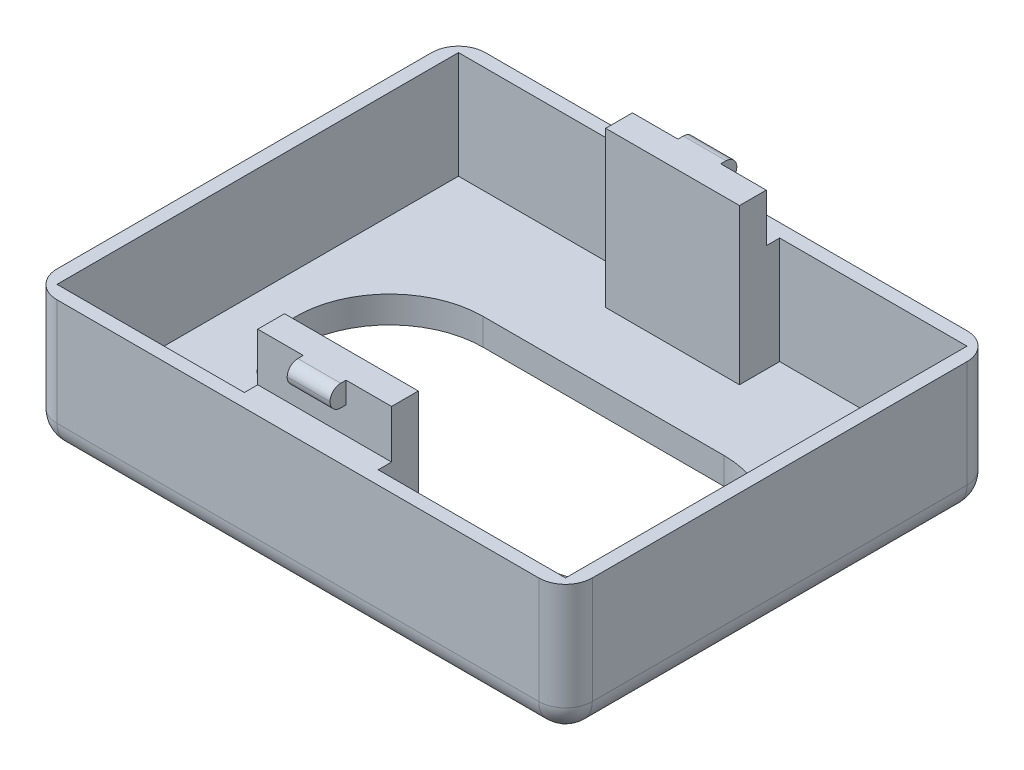
from build123d import *

# Parameters (mm, degrees)
SKETCH1_W            = 100
SKETCH1_H            = 80
BOSS_EXTRUDE1_DEPTH  = 5
SKETCH2_W            = 100
SKETCH2_H            = 80
SKETCH2_W_2          = 95
SKETCH2_H_2          = 75
BOSS_EXTRUDE2_DEPTH  = 20
SKETCH3_W            = 25
SKETCH3_H            = 7.5
BOSS_EXTRUDE3_DEPTH  = 20
SKETCH4_W            = 25
SKETCH4_H            = 5
BOSS_EXTRUDE4_DEPTH  = 9
SKETCH5_W            = 8
SKETCH5_H            = 4
BOSS_EXTRUDE5_DEPTH  = 3
FILLET1_R            = 2
FILLET2_R            = 5
FILLET1_OF_MIRROR2_R = 2
CUT_EXTRUDE1_DEPTH   = 132.304988481


with BuildPart() as part:
    # Sketch1 → Boss-Extrude1 (new body)
    with BuildSketch(Plane(origin=(0, 0, 0), x_dir=(1, 0, 0), z_dir=(0, 1, 0))):
        with Locations((50, 40)):
            Rectangle(SKETCH1_W, SKETCH1_H)
    extrude(amount=BOSS_EXTRUDE1_DEPTH)

    # Sketch2 → Boss-Extrude2 (add)
    with BuildSketch(Plane(origin=(0, 5, 0), x_dir=(1, 0, 0), z_dir=(0, 1, 0))):
        with Locations((50, 40)):
            Rectangle(SKETCH2_W, SKETCH2_H)
        with Locations((50, 40)):
            Rectangle(SKETCH2_W_2, SKETCH2_H_2, mode=Mode.SUBTRACT)
    extrude(amount=BOSS_EXTRUDE2_DEPTH)

    # Sketch3 → Boss-Extrude3 (add)
    with BuildSketch(Plane(origin=(0, 5, 0), x_dir=(1, 0, 0), z_dir=(0, 1, 0))):
        with Locations((50, 73.75)):
            Rectangle(SKETCH3_W, SKETCH3_H)
    boss_extrude3 = extrude(amount=BOSS_EXTRUDE3_DEPTH)

    # Sketch4 → Boss-Extrude4 (add)
    with BuildSketch(Plane(origin=(0, 25, 0), x_dir=(1, 0, 0), z_dir=(0, 1, 0))):
        with Locations((50, 72.5)):
            Rectangle(SKETCH4_W, SKETCH4_H)
    boss_extrude4 = extrude(amount=BOSS_EXTRUDE4_DEPTH)

    # Sketch5 → Boss-Extrude5 (add)
    with BuildSketch(Plane(origin=(0, 0, -75), x_dir=(-1, 0, 0), z_dir=(0, 0, -1))):
        with Locations((-50, 32)):
            Rectangle(SKETCH5_W, SKETCH5_H)
    boss_extrude5 = extrude(amount=BOSS_EXTRUDE5_DEPTH)

    # Fillet1
    fillet1_edges = [part.edges().sort_by_distance(p)[0] for p in [
        (50, 30, -78),
        (50, 34, -78),
    ]]
    fillet(fillet1_edges, radius=FILLET1_R - 0.0001)  # a hair under: the kernel refuses the full size

    # Fillet2
    fillet2_edges = [part.edges().sort_by_distance(p)[0] for p in [
        (50, 0, -80),
        (100, 0, -40),
        (50, 0, 0),
        (0, 0, -40),
        (0, 12.5, -80),
        (100, 12.5, -80),
        (100, 12.5, 0),
        (0, 12.5, 0),
    ]]
    fillet(fillet2_edges, radius=FILLET2_R)

    # Mirror2: Boss-Extrude3, Boss-Extrude4, Boss-Extrude5 across plane
    add(boss_extrude3.mirror(Plane.XY.offset(-40)))
    add(boss_extrude4.mirror(Plane.XY.offset(-40)))
    add(boss_extrude5.mirror(Plane.XY.offset(-40)))

    # Fillet1 of Mirror2
    fillet1_of_mirror2_edges = [part.edges().sort_by_distance(p)[0] for p in [
        (50, 30, -2),
        (50, 34, -2),
    ]]
    fillet(fillet1_of_mirror2_edges, radius=FILLET1_OF_MIRROR2_R - 0.0001)  # a hair under: the kernel refuses the full size

    # Sketch6 → Cut-Extrude1 (cut, through all)
    with BuildSketch(Plane(origin=(0, 5, 0), x_dir=(1, 0, 0), z_dir=(0, 1, 0))):
        with BuildLine():
            Line((27.5, 57.120387913), (72.5, 57.120387913))
            ThreePointArc((72.5, 57.120387913), (90, 39.620387913), (72.5, 22.120387913))
            Line((72.5, 22.120387913), (27.5, 22.120387913))
            ThreePointArc((27.5, 22.120387913), (10.000000977, 39.620387913), (27.5, 57.120387913))
        make_face()
    extrude(amount=-CUT_EXTRUDE1_DEPTH, mode=Mode.SUBTRACT)


solid = part.part
